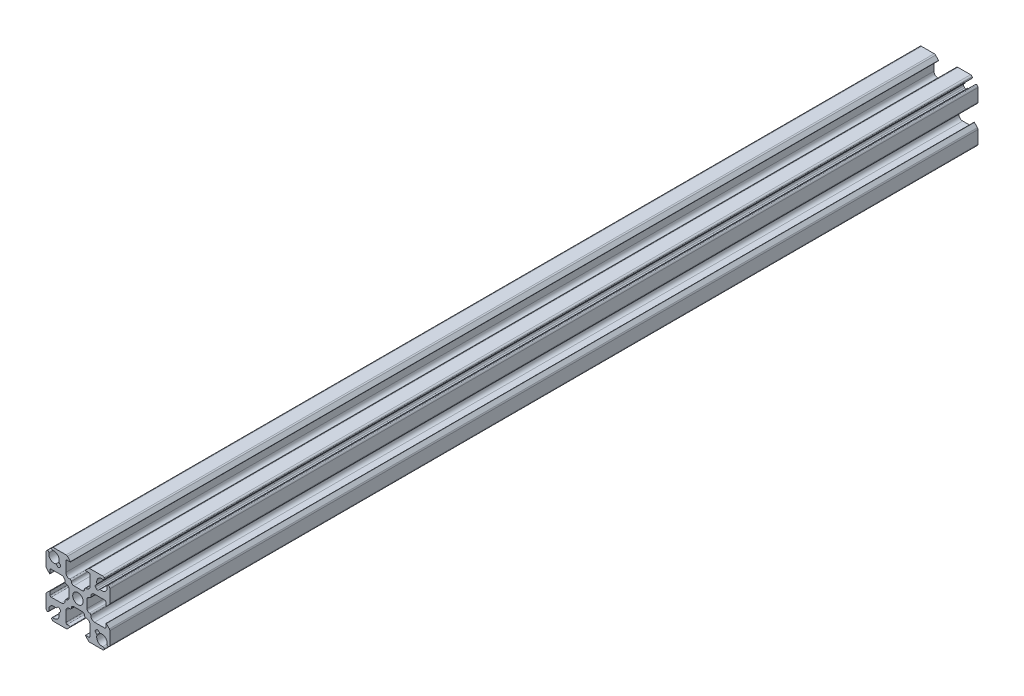
from build123d import *

# Parameters (mm, degrees)
SKETCH1_R                            = 2.08
BOSS_EXTRUDE1_DEPTH                  = 172.5549
SKETCH2_W                            = 2.5
SKETCH2_H                            = 16.3
TAP_DRILL_FOR_M6X1_0_TAP2_AT_2_COUNT = 2
TAP_DRILL_FOR_M6X1_0_TAP2_AT_2_PITCH = 135.89
SKETCH4_W                            = 2.5
SKETCH4_H                            = 16.3
TAP_DRILL_FOR_M6X1_0_TAP1_AT_2_COUNT = 2
TAP_DRILL_FOR_M6X1_0_TAP1_AT_2_PITCH = 120
TAP_DRILL_FOR_M6X1_0_TAP1_AT_3_COUNT = 2
TAP_DRILL_FOR_M6X1_0_TAP1_AT_3_PITCH = 240


with BuildPart() as part:
    # Sketch1 → Boss-Extrude1 (new, symmetric)
    with BuildSketch(Plane(origin=(0, 0, 0), x_dir=(-1, 0, 0), z_dir=(0, 0, -1))):
        with BuildLine():
            Line((-7.48853247, 8.61990332), (-6.985643798, 8.117014648))
            ThreePointArc((-6.985643798, 8.117014648), (-6.839197188, 7.763461257), (-6.985643798, 7.409907866))
            Line((-6.985643798, 7.409907866), (-7.409907866, 6.985643798))
            ThreePointArc((-7.409907866, 6.985643798), (-7.763461257, 6.839197188), (-8.117014648, 6.985643798))
            Line((-8.117014648, 6.985643798), (-8.61990332, 7.48853247))
            ThreePointArc((-8.61990332, 7.48853247), (-8.738774884, 7.554957329), (-8.874825936, 7.549228331))
            ThreePointArc((-8.874825936, 7.549228331), (-10.889377278, 7.955008076), (-11.572136222, 9.893284252))
            ThreePointArc((-11.572136222, 9.893284252), (-11.766795458, 10.383720777), (-12.292708824, 10.42656157))
            ThreePointArc((-12.292708824, 10.42656157), (-12.590129525, 10.150252615), (-12.7, 9.759440396))
            Line((-12.7, 9.759440396), (-12.7, 4.710660172))
            ThreePointArc((-12.7, 4.710660172), (-12.642909649, 4.423647598), (-12.480330086, 4.180330086))
            Line((-12.480330086, 4.180330086), (-11.270710678, 2.970710678))
            ThreePointArc((-11.270710678, 2.970710678), (-11.161731657, 2.949033403), (-11.1, 3.041421356))
            Line((-11.1, 3.041421356), (-11.1, 4.325))
            ThreePointArc((-11.1, 4.325), (-10.953553391, 4.678553391), (-10.6, 4.825))
            Line((-10.6, 4.825), (-6.6, 4.825))
            ThreePointArc((-6.6, 4.825), (-5.539339828, 4.385660172), (-5.1, 3.325))
            Line((-5.1, 3.325), (-5.1, 3.15))
            ThreePointArc((-5.1, 3.15), (-4.953553391, 2.796446609), (-4.6, 2.65))
            ThreePointArc((-4.6, 2.65), (-3.892893219, 2.357106781), (-3.6, 1.65))
            Line((-3.6, 1.65), (-3.6, -1.65))
            ThreePointArc((-3.6, -1.65), (-3.892893219, -2.357106781), (-4.6, -2.65))
            ThreePointArc((-4.6, -2.65), (-4.953553391, -2.796446609), (-5.1, -3.15))
            Line((-5.1, -3.15), (-5.1, -3.325))
            ThreePointArc((-5.1, -3.325), (-5.539339828, -4.385660172), (-6.6, -4.825))
            Line((-6.6, -4.825), (-10.6, -4.825))
            ThreePointArc((-10.6, -4.825), (-10.953553391, -4.678553391), (-11.1, -4.325))
            Line((-11.1, -4.325), (-11.1, -3.041421356))
            ThreePointArc((-11.1, -3.041421356), (-11.161731657, -2.949033403), (-11.270710678, -2.970710678))
            Line((-11.270710678, -2.970710678), (-12.480330086, -4.180330086))
            ThreePointArc((-12.480330086, -4.180330086), (-12.642909649, -4.423647598), (-12.7, -4.710660172))
            Line((-12.7, -4.710660172), (-12.7, -9.759440396))
            ThreePointArc((-12.7, -9.759440396), (-12.590129525, -10.150252615), (-12.292708824, -10.42656157))
            ThreePointArc((-12.292708824, -10.42656157), (-11.766795458, -10.383720777), (-11.572136222, -9.893284252))
            ThreePointArc((-11.572136222, -9.893284252), (-10.889377278, -7.955008076), (-8.874825936, -7.549228331))
            ThreePointArc((-8.874825936, -7.549228331), (-8.738774884, -7.554957329), (-8.61990332, -7.48853247))
            Line((-8.61990332, -7.48853247), (-8.117014648, -6.985643798))
            ThreePointArc((-8.117014648, -6.985643798), (-7.763461257, -6.839197188), (-7.409907866, -6.985643798))
            Line((-7.409907866, -6.985643798), (-6.985643798, -7.409907866))
            ThreePointArc((-6.985643798, -7.409907866), (-6.839197188, -7.763461257), (-6.985643798, -8.117014648))
            Line((-6.985643798, -8.117014648), (-7.48853247, -8.61990332))
            ThreePointArc((-7.48853247, -8.61990332), (-7.554957329, -8.738774884), (-7.549228331, -8.874825936))
            ThreePointArc((-7.549228331, -8.874825936), (-7.955008076, -10.889377278), (-9.893284252, -11.572136222))
            ThreePointArc((-9.893284252, -11.572136222), (-10.383720777, -11.766795458), (-10.42656157, -12.292708824))
            ThreePointArc((-10.42656157, -12.292708824), (-10.150252615, -12.590129525), (-9.759440396, -12.7))
            Line((-9.759440396, -12.7), (-4.710660172, -12.7))
            ThreePointArc((-4.710660172, -12.7), (-4.423647598, -12.642909649), (-4.180330086, -12.480330086))
            Line((-4.180330086, -12.480330086), (-2.970710678, -11.270710678))
            ThreePointArc((-2.970710678, -11.270710678), (-2.949033403, -11.161731657), (-3.041421356, -11.1))
            Line((-3.041421356, -11.1), (-4.325, -11.1))
            ThreePointArc((-4.325, -11.1), (-4.678553391, -10.953553391), (-4.825, -10.6))
            Line((-4.825, -10.6), (-4.825, -6.6))
            ThreePointArc((-4.825, -6.6), (-4.385660172, -5.539339828), (-3.325, -5.1))
            Line((-3.325, -5.1), (-3.15, -5.1))
            ThreePointArc((-3.15, -5.1), (-2.796446609, -4.953553391), (-2.65, -4.6))
            ThreePointArc((-2.65, -4.6), (-2.357106781, -3.892893219), (-1.65, -3.6))
            Line((-1.65, -3.6), (1.65, -3.6))
            ThreePointArc((1.65, -3.6), (2.357106781, -3.892893219), (2.65, -4.6))
            ThreePointArc((2.65, -4.6), (2.796446609, -4.953553391), (3.15, -5.1))
            Line((3.15, -5.1), (3.325, -5.1))
            ThreePointArc((3.325, -5.1), (4.385660172, -5.539339828), (4.825, -6.6))
            Line((4.825, -6.6), (4.825, -10.6))
            ThreePointArc((4.825, -10.6), (4.678553391, -10.953553391), (4.325, -11.1))
            Line((4.325, -11.1), (3.041421356, -11.1))
            ThreePointArc((3.041421356, -11.1), (2.949033403, -11.161731657), (2.970710678, -11.270710678))
            Line((2.970710678, -11.270710678), (4.180330086, -12.480330086))
            ThreePointArc((4.180330086, -12.480330086), (4.423647598, -12.642909649), (4.710660172, -12.7))
            Line((4.710660172, -12.7), (9.759440396, -12.7))
            ThreePointArc((9.759440396, -12.7), (10.150252615, -12.590129525), (10.42656157, -12.292708824))
            ThreePointArc((10.42656157, -12.292708824), (10.383720777, -11.766795458), (9.893284252, -11.572136222))
            ThreePointArc((9.893284252, -11.572136222), (7.955008076, -10.889377278), (7.549228331, -8.874825936))
            ThreePointArc((7.549228331, -8.874825936), (7.554957329, -8.738774884), (7.48853247, -8.61990332))
            Line((7.48853247, -8.61990332), (6.985643798, -8.117014648))
            ThreePointArc((6.985643798, -8.117014648), (6.839197188, -7.763461257), (6.985643798, -7.409907866))
            Line((6.985643798, -7.409907866), (7.409907866, -6.985643798))
            ThreePointArc((7.409907866, -6.985643798), (7.763461257, -6.839197188), (8.117014648, -6.985643798))
            Line((8.117014648, -6.985643798), (8.61990332, -7.48853247))
            ThreePointArc((8.61990332, -7.48853247), (8.738774884, -7.554957329), (8.874825936, -7.549228331))
            ThreePointArc((8.874825936, -7.549228331), (10.889377278, -7.955008076), (11.572136222, -9.893284252))
            ThreePointArc((11.572136222, -9.893284252), (11.766795458, -10.383720777), (12.292708824, -10.42656157))
            ThreePointArc((12.292708824, -10.42656157), (12.590129525, -10.150252615), (12.7, -9.759440396))
            Line((12.7, -9.759440396), (12.7, -4.710660172))
            ThreePointArc((12.7, -4.710660172), (12.642909649, -4.423647598), (12.480330086, -4.180330086))
            Line((12.480330086, -4.180330086), (11.270710678, -2.970710678))
            ThreePointArc((11.270710678, -2.970710678), (11.161731657, -2.949033403), (11.1, -3.041421356))
            Line((11.1, -3.041421356), (11.1, -4.325))
            ThreePointArc((11.1, -4.325), (10.953553391, -4.678553391), (10.6, -4.825))
            Line((10.6, -4.825), (6.6, -4.825))
            ThreePointArc((6.6, -4.825), (5.539339828, -4.385660172), (5.1, -3.325))
            Line((5.1, -3.325), (5.1, -3.15))
            ThreePointArc((5.1, -3.15), (4.953553391, -2.796446609), (4.6, -2.65))
            ThreePointArc((4.6, -2.65), (3.892893219, -2.357106781), (3.6, -1.65))
            Line((3.6, -1.65), (3.6, 1.65))
            ThreePointArc((3.6, 1.65), (3.892893219, 2.357106781), (4.6, 2.65))
            ThreePointArc((4.6, 2.65), (4.953553391, 2.796446609), (5.1, 3.15))
            Line((5.1, 3.15), (5.1, 3.325))
            ThreePointArc((5.1, 3.325), (5.539339828, 4.385660172), (6.6, 4.825))
            Line((6.6, 4.825), (10.6, 4.825))
            ThreePointArc((10.6, 4.825), (10.953553391, 4.678553391), (11.1, 4.325))
            Line((11.1, 4.325), (11.1, 3.041421356))
            ThreePointArc((11.1, 3.041421356), (11.161731657, 2.949033403), (11.270710678, 2.970710678))
            Line((11.270710678, 2.970710678), (12.480330086, 4.180330086))
            ThreePointArc((12.480330086, 4.180330086), (12.642909649, 4.423647598), (12.7, 4.710660172))
            Line((12.7, 4.710660172), (12.7, 9.759440396))
            ThreePointArc((12.7, 9.759440396), (12.590129525, 10.150252615), (12.292708824, 10.42656157))
            ThreePointArc((12.292708824, 10.42656157), (11.766795458, 10.383720777), (11.572136222, 9.893284252))
            ThreePointArc((11.572136222, 9.893284252), (10.889377278, 7.955008076), (8.874825936, 7.549228331))
            ThreePointArc((8.874825936, 7.549228331), (8.738774884, 7.554957329), (8.61990332, 7.48853247))
            Line((8.61990332, 7.48853247), (8.117014648, 6.985643798))
            ThreePointArc((8.117014648, 6.985643798), (7.763461257, 6.839197188), (7.409907866, 6.985643798))
            Line((7.409907866, 6.985643798), (6.985643798, 7.409907866))
            ThreePointArc((6.985643798, 7.409907866), (6.839197188, 7.763461257), (6.985643798, 8.117014648))
            Line((6.985643798, 8.117014648), (7.48853247, 8.61990332))
            ThreePointArc((7.48853247, 8.61990332), (7.554957329, 8.738774884), (7.549228331, 8.874825936))
            ThreePointArc((7.549228331, 8.874825936), (7.955008076, 10.889377278), (9.893284252, 11.572136222))
            ThreePointArc((9.893284252, 11.572136222), (10.383720777, 11.766795458), (10.42656157, 12.292708824))
            ThreePointArc((10.42656157, 12.292708824), (10.150252615, 12.590129525), (9.759440396, 12.7))
            Line((9.759440396, 12.7), (4.710660172, 12.7))
            ThreePointArc((4.710660172, 12.7), (4.423647598, 12.642909649), (4.180330086, 12.480330086))
            Line((4.180330086, 12.480330086), (2.970710678, 11.270710678))
            ThreePointArc((2.970710678, 11.270710678), (2.949033403, 11.161731657), (3.041421356, 11.1))
            Line((3.041421356, 11.1), (4.325, 11.1))
            ThreePointArc((4.325, 11.1), (4.678553391, 10.953553391), (4.825, 10.6))
            Line((4.825, 10.6), (4.825, 6.6))
            ThreePointArc((4.825, 6.6), (4.385660172, 5.539339828), (3.325, 5.1))
            Line((3.325, 5.1), (3.15, 5.1))
            ThreePointArc((3.15, 5.1), (2.796446609, 4.953553391), (2.65, 4.6))
            ThreePointArc((2.65, 4.6), (2.357106781, 3.892893219), (1.65, 3.6))
            Line((1.65, 3.6), (-1.65, 3.6))
            ThreePointArc((-1.65, 3.6), (-2.357106781, 3.892893219), (-2.65, 4.6))
            ThreePointArc((-2.65, 4.6), (-2.796446609, 4.953553391), (-3.15, 5.1))
            Line((-3.15, 5.1), (-3.325, 5.1))
            ThreePointArc((-3.325, 5.1), (-4.385660172, 5.539339828), (-4.825, 6.6))
            Line((-4.825, 6.6), (-4.825, 10.6))
            ThreePointArc((-4.825, 10.6), (-4.678553391, 10.953553391), (-4.325, 11.1))
            Line((-4.325, 11.1), (-3.041421356, 11.1))
            ThreePointArc((-3.041421356, 11.1), (-2.949033403, 11.161731657), (-2.970710678, 11.270710678))
            Line((-2.970710678, 11.270710678), (-4.180330086, 12.480330086))
            ThreePointArc((-4.180330086, 12.480330086), (-4.423647598, 12.642909649), (-4.710660172, 12.7))
            Line((-4.710660172, 12.7), (-9.759440396, 12.7))
            ThreePointArc((-9.759440396, 12.7), (-10.150252615, 12.590129525), (-10.42656157, 12.292708824))
            ThreePointArc((-10.42656157, 12.292708824), (-10.383720777, 11.766795458), (-9.893284252, 11.572136222))
            ThreePointArc((-9.893284252, 11.572136222), (-7.955008076, 10.889377278), (-7.549228331, 8.874825936))
            ThreePointArc((-7.549228331, 8.874825936), (-7.554957329, 8.738774884), (-7.48853247, 8.61990332))
        make_face()
        Circle(SKETCH1_R, mode=Mode.SUBTRACT)
    extrude(amount=BOSS_EXTRUDE1_DEPTH, both=True)

    # Sketch2 → Tap Drill for M6x1.0 Tap2 (revolve, cut)
    with BuildSketch(Plane(origin=(3.6, -5.307989145, 121.342889144), x_dir=(0, 0, -1), z_dir=(0, 1, 0))):
        with Locations((1.25, 8.15)):
            Rectangle(SKETCH2_W, SKETCH2_H)
    tap_drill_for_m6x1_0_tap2 = revolve(axis=Axis((9.95, -5.307989145, 121.342889144), (-1, 0, 0)), mode=Mode.SUBTRACT)

    # Tap Drill for M6x1.0 Tap2 at 2: Tap Drill for M6x1.0 Tap2 ×2
    with Locations(*[(0, 0, -i * TAP_DRILL_FOR_M6X1_0_TAP2_AT_2_PITCH) for i in range(1, TAP_DRILL_FOR_M6X1_0_TAP2_AT_2_COUNT)]):
        add(tap_drill_for_m6x1_0_tap2, mode=Mode.SUBTRACT)

    # Sketch4 → Tap Drill for M6x1.0 Tap1 (revolve, cut)
    with BuildSketch(Plane(origin=(-3.6, 0, 132.554900049), x_dir=(0, 0, 1), z_dir=(0, 1, 0))):
        with Locations((1.25, 8.15)):
            Rectangle(SKETCH4_W, SKETCH4_H)
    tap_drill_for_m6x1_0_tap1 = revolve(axis=Axis((-9.95, 0, 132.554900049), (1, 0, 0)), mode=Mode.SUBTRACT)

    # Tap Drill for M6x1.0 Tap1 at 2: Tap Drill for M6x1.0 Tap1 ×2
    with Locations(*[(0, 0, -i * TAP_DRILL_FOR_M6X1_0_TAP1_AT_2_PITCH) for i in range(1, TAP_DRILL_FOR_M6X1_0_TAP1_AT_2_COUNT)]):
        add(tap_drill_for_m6x1_0_tap1, mode=Mode.SUBTRACT)

    # Tap Drill for M6x1.0 Tap1 at 3: Tap Drill for M6x1.0 Tap1 ×2
    with Locations(*[(0, 0, -i * TAP_DRILL_FOR_M6X1_0_TAP1_AT_3_PITCH) for i in range(1, TAP_DRILL_FOR_M6X1_0_TAP1_AT_3_COUNT)]):
        add(tap_drill_for_m6x1_0_tap1, mode=Mode.SUBTRACT)


solid = part.part
